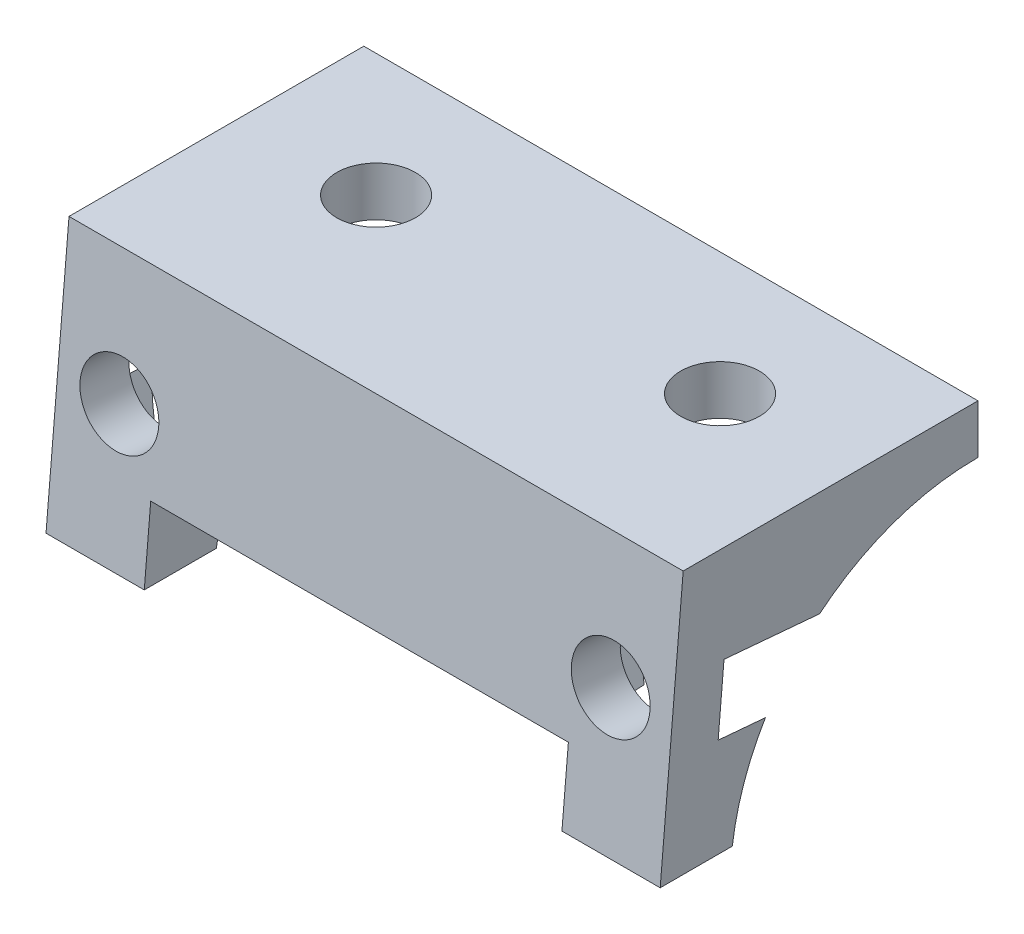
from build123d import *
from build123d.topology import SkipClean

# Parameters (mm, degrees)
BOSS_EXTRUDE1_DEPTH = 2
SKETCH2_W           = 25
SKETCH2_H           = 2
BOSS_EXTRUDE2_DEPTH = 10
SKETCH3_R           = 1.6
CUT_EXTRUDE1_DEPTH  = 10
FILLET5_START       = -12.5
FILLET5_DEPTH       = 25
FILLET5_2_DEPTH     = 4
FILLET5_START_2     = 8.5
FILLET5_3_DEPTH     = 4
FILLET5_4_OUTLINE_R = 1.6
FILLET5_4_DEPTH     = 3.35
CUT_EXTRUDE3_DEPTH  = 10
BOSS_EXTRUDE3_DEPTH = 4
BOSS_EXTRUDE4_START = -21
BOSS_EXTRUDE4_DEPTH = 4
BOSS_EXTRUDE5_REACH = 25.867
SKETCH9_R           = 1.6
CUT_EXTRUDE5_DEPTH  = 10
CUT_EXTRUDE4_START  = 2
CUT_EXTRUDE4_DEPTH  = 10


with BuildPart() as part:
    # Sketch1 → Boss-Extrude1 (new body)
    with BuildSketch(Plane.XY):
        Polygon((8.5, -5.35), (12.5, -5.35), (12.5, 5.35), (-12.5, 5.35), (-12.5, -5.35), (-8.5, -5.35), (-8.5, -2.35), (8.5, -2.35), align=None)
    extrude(amount=BOSS_EXTRUDE1_DEPTH)

    # Sketch2 → Boss-Extrude2 (add)
    with BuildSketch(Plane(origin=(0, 0, 0), x_dir=(-1, 0, 0), z_dir=(0, 0, -1))):
        with Locations((0, 4.35)):
            Rectangle(SKETCH2_W, SKETCH2_H)
    extrude(amount=BOSS_EXTRUDE2_DEPTH)

    # Sketch3 → Cut-Extrude1 (cut)
    with BuildSketch(Plane(origin=(0, 5.35, 0), x_dir=(1, 0, 0), z_dir=(0, 1, 0))):
        with Locations(Location((-7, 5, 0), (0, 0, 270))):
            Circle(SKETCH3_R)
        with Locations(Location((7, 5, 0), (0, 0, 270))):
            Circle(SKETCH3_R)
    extrude(amount=-CUT_EXTRUDE1_DEPTH, mode=Mode.SUBTRACT)

    # Fillet5: read off the stored shape, not the designer's step
    # Fillet5 outline → Fillet5 (add)
    with BuildSketch(Plane.YZ.offset(FILLET5_START)):
        with BuildLine():
            Line((-2.35, 0), (-2.35, -0.886851064))
            ThreePointArc((-2.35, -0.886851064), (1.805767263, -4.576600812), (3.35, -9.915139938))
            Line((3.35, -9.915139938), (3.35, 0))
            Line((3.35, 0), (-2.35, 0))
        make_face()
    extrude(amount=FILLET5_DEPTH)

    # Fillet5 2 outline → Fillet5 2 (add)
    with BuildSketch(Plane.YZ.offset(FILLET5_START)):
        with BuildLine():
            ThreePointArc((-5.35, 0), (-3.81510561, -0.325386355), (-2.35, -0.886851064))
            Line((-2.35, -0.886851064), (-2.35, 0))
            Line((-2.35, 0), (-5.35, 0))
        make_face()
    extrude(amount=FILLET5_2_DEPTH)

    # Fillet5 3 outline → Fillet5 3 (add)
    with BuildSketch(Plane.YZ.offset(FILLET5_START_2)):
        with BuildLine():
            ThreePointArc((-5.35, 0), (-3.81510561, -0.325386355), (-2.35, -0.886851064))
            Line((-2.35, -0.886851064), (-2.35, 0))
            Line((-2.35, 0), (-5.35, 0))
        make_face()
    extrude(amount=FILLET5_3_DEPTH)

    # Fillet5 4 outline → Fillet5 4 (cut)
    with SkipClean():  # the faces are left unmerged after this step: merging them gives an invalid solid
        with BuildSketch(Plane(origin=(0, 0, 0), x_dir=(1, 0, 0), z_dir=(0, 1, 0))):
            with Locations((7, 5)):
                Circle(FILLET5_4_OUTLINE_R)
            with Locations((-7, 5)):
                Circle(FILLET5_4_OUTLINE_R)
        extrude(amount=FILLET5_4_DEPTH, mode=Mode.SUBTRACT)

    # Sketch4 → Cut-Extrude3 (cut)
    with BuildSketch(Plane(origin=(0, 3.35, 0), x_dir=(1, 0, 0), z_dir=(0, 1, 0))):
        Polygon((-3.709103466, 5), (-5.354551733, 7.85), (-8.645448267, 7.85), (-10.290896534, 5), (-8.645448267, 2.15), (-5.354551733, 2.15), align=None)
        Polygon((3.709103466, 5), (5.354551733, 2.15), (8.645448267, 2.15), (10.290896534, 5), (8.645448267, 7.85), (5.354551733, 7.85), align=None)
    extrude(amount=-CUT_EXTRUDE3_DEPTH, mode=Mode.SUBTRACT)

    # Sketch7 → Boss-Extrude3 (add)
    with BuildSketch(Plane.ZY.offset(12.5)):
        Polygon((2, -5.35), (2.9361287, -5.35), (2, 5.35), align=None)
    extrude(amount=-BOSS_EXTRUDE3_DEPTH)

    # Sketch7<2> → Boss-Extrude4 (add)
    with BuildSketch(Plane.ZY.offset(12.5).offset(BOSS_EXTRUDE4_START)):
        Polygon((2, -5.35), (2.9361287, -5.35), (2, 5.35), align=None)
    extrude(amount=-BOSS_EXTRUDE4_DEPTH)

    # Sketch10 → Boss-Extrude5 (add, up to next)
    with BuildSketch(Plane.ZY.offset(-8.5), mode=Mode.PRIVATE) as boss_extrude5_sk1:
        Polygon((2, -2.35), (2.673662709, -2.35), (2, 5.35), align=None)
    boss_extrude5_tool1 = extrude(boss_extrude5_sk1.sketch, amount=BOSS_EXTRUDE5_REACH, mode=Mode.PRIVATE) - part.part
    add(boss_extrude5_tool1.solids().sort_by_distance((8.5, 0.216667, 2.224554))[0])

    # Sketch9 → Cut-Extrude5 (cut)
    with BuildSketch(Plane(origin=(0, 0.214287438, 2.449316628), x_dir=(1, 0, 0), z_dir=(0, 0.08715574274766177, 0.9961946980917453))):
        with Locations(Location((-10, 0, 0), (0, 0, 270))):
            Circle(SKETCH9_R)
        with Locations(Location((10, 0, 0), (0, 0, 270))):
            Circle(SKETCH9_R)
    extrude(amount=-CUT_EXTRUDE5_DEPTH, mode=Mode.SUBTRACT)

    # Sketch6 → Cut-Extrude4 (cut)
    with BuildSketch(Plane(origin=(0, 10.679641635, 1.533716776), x_dir=(1, 0, 0), z_dir=(0, -0.08715574274766179, -0.9961946980917453)).offset(CUT_EXTRUDE4_START)):
        Polygon((-6.709103466, 10.505330149), (-8.354551733, 13.355330149), (-11.645448267, 13.355330149), (-13.290896534, 10.505330149), (-11.645448267, 7.655330149), (-8.354551733, 7.655330149), align=None)
        Polygon((6.709103466, 10.505330149), (8.354551733, 7.655330149), (11.645448267, 7.655330149), (13.290896534, 10.505330149), (11.645448267, 13.355330149), (8.354551733, 13.355330149), align=None)
    extrude(amount=CUT_EXTRUDE4_DEPTH, mode=Mode.SUBTRACT)


solid = part.part
